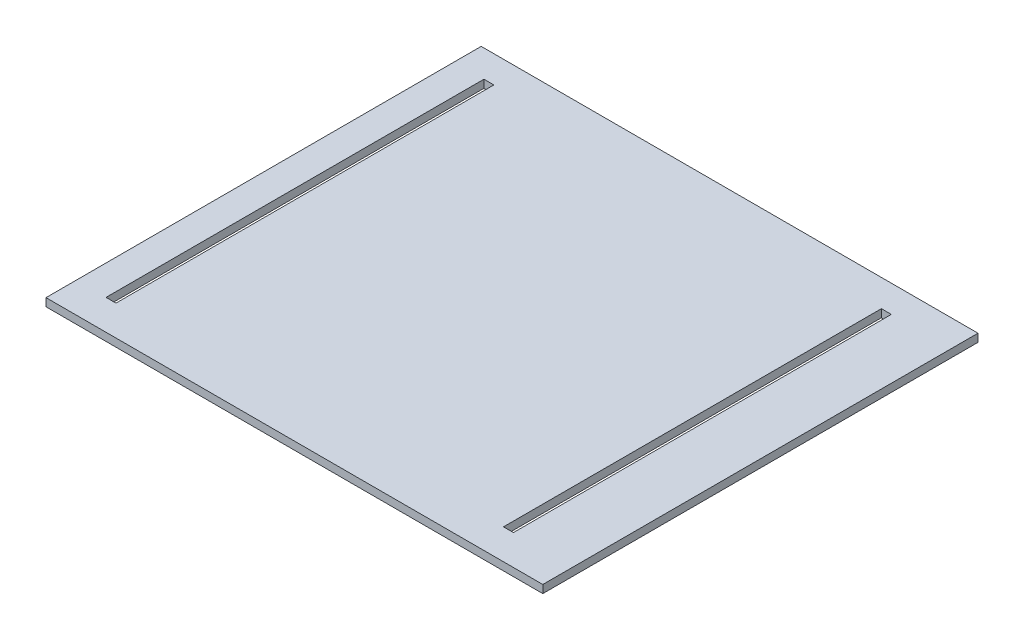
from build123d import *

# Parameters (mm, degrees)
SKETCH1_W           = 250
SKETCH1_H           = 219
SKETCH1_W_2         = 5
SKETCH1_H_2         = 190.1710485
BOSS_EXTRUDE1_DEPTH = 4


with BuildPart() as part:
    # Sketch1 → Boss-Extrude1 (new body)
    with BuildSketch(Plane(origin=(0, 0, 0), x_dir=(1, 0, 0), z_dir=(0, 1, 0))):
        Rectangle(SKETCH1_W, SKETCH1_H)
        with Locations((-107.5, 0.80041533)):
            Rectangle(SKETCH1_W_2, SKETCH1_H_2, mode=Mode.SUBTRACT)
        with Locations((92.5, 0.80041533)):
            Rectangle(SKETCH1_W_2, SKETCH1_H_2, mode=Mode.SUBTRACT)
    extrude(amount=BOSS_EXTRUDE1_DEPTH)


solid = part.part
